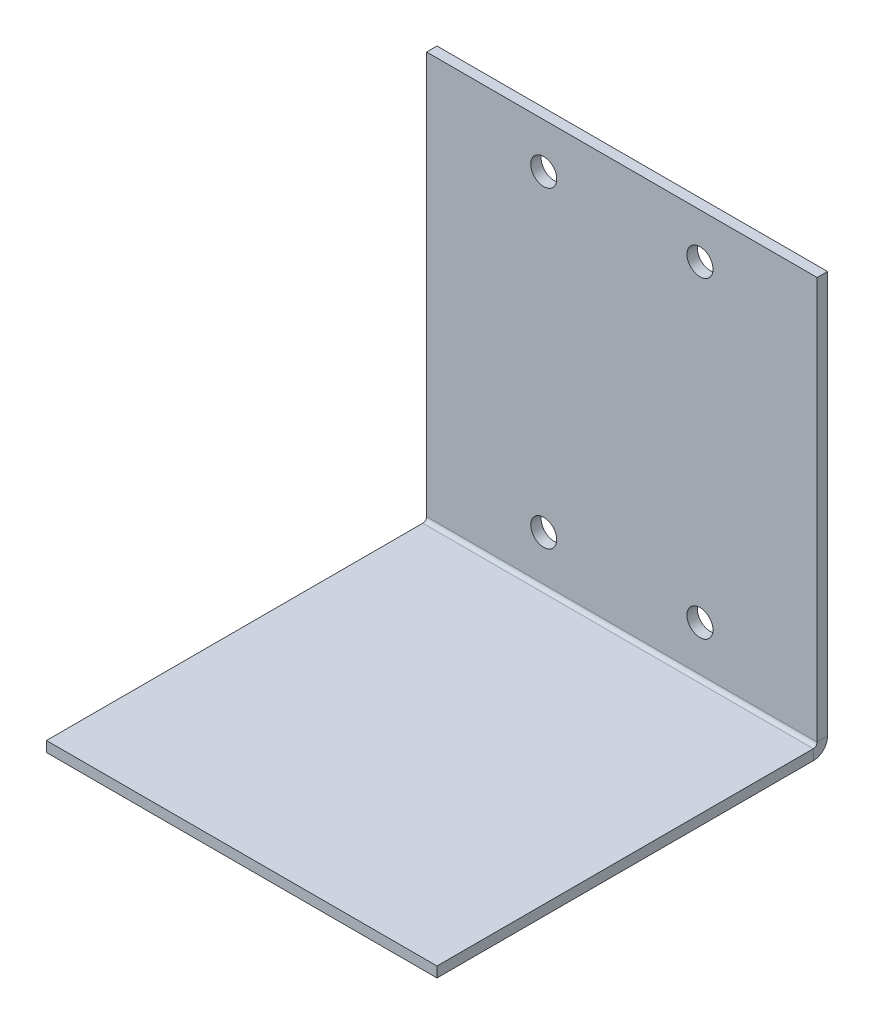
from build123d import *

# Parameters (mm, degrees)
SKETCH2_W                    = 75
SKETCH2_H                    = 80
BASE_FLANGE1_DEPTH           = 2
EDGE_FLANGE1_STRIP_W         = 9.4732
EDGE_FLANGE1_STRIP_H         = 2
EDGE_FLANGE1_STRIP_CUT_DEPTH = 75
EDGE_FLANGE1_DEPTH           = 75
CUT_EXTRUDE1_REACH           = 134.853
SKETCH10_R                   = 2.5


# Sheet-metal steps are written as plain solids
with BuildPart() as part:
    # Sketch2 → Base-Flange1 (new body)
    with BuildSketch(Plane.XY):
        with Locations((37.5, 40)):
            Rectangle(SKETCH2_W, SKETCH2_H)
    extrude(amount=-BASE_FLANGE1_DEPTH)

    # Edge-Flange1 strip (across the edge) → Edge-Flange1 strip cut (cut)
    with BuildSketch(Plane.YZ):
        with Locations((-2, -1)):
            Rectangle(EDGE_FLANGE1_STRIP_W, EDGE_FLANGE1_STRIP_H)
    extrude(amount=EDGE_FLANGE1_STRIP_CUT_DEPTH, mode=Mode.SUBTRACT)

    # Edge-Flange1 section (across the edge) → Edge-Flange1 (add)
    with BuildSketch(Plane.YZ):
        with BuildLine():
            Line((0, 0.7366), (0, 73))
            Line((0, 73), (2, 73))
            Line((2, 73), (2, 0.7366))
            ThreePointArc((2, 0.7366), (2.215745145, 0.215745145), (2.7366, 0))
            Line((2.7366, 0), (2.7366, -2))
            ThreePointArc((2.7366, -2), (0.801531583, -1.198468417), (0, 0.7366))
        make_face()
    extrude(amount=EDGE_FLANGE1_DEPTH)

    # Sketch10 → Cut-Extrude1 (cut, up to next)
    with BuildSketch(Plane(origin=(0, 0, -2), x_dir=(-1, 0, 0), z_dir=(0, 0, -1)), mode=Mode.PRIVATE) as cut_extrude1_sk1:
        with Locations((-22.5, 11.37)):
            Circle(SKETCH10_R)
    cut_extrude1_tool1 = extrude(cut_extrude1_sk1.sketch, amount=-CUT_EXTRUDE1_REACH, mode=Mode.PRIVATE) & part.part
    # Sketch10 → Cut-Extrude1 (cut, up to next)
    with BuildSketch(Plane(origin=(0, 0, -2), x_dir=(-1, 0, 0), z_dir=(0, 0, -1)), mode=Mode.PRIVATE) as cut_extrude1_sk2:
        with Locations((-52.5, 71.37)):
            Circle(SKETCH10_R)
    cut_extrude1_tool2 = extrude(cut_extrude1_sk2.sketch, amount=-CUT_EXTRUDE1_REACH, mode=Mode.PRIVATE) & part.part
    # Sketch10 → Cut-Extrude1 (cut, up to next)
    with BuildSketch(Plane(origin=(0, 0, -2), x_dir=(-1, 0, 0), z_dir=(0, 0, -1)), mode=Mode.PRIVATE) as cut_extrude1_sk3:
        with Locations((-52.5, 11.3666)):
            Circle(SKETCH10_R)
    cut_extrude1_tool3 = extrude(cut_extrude1_sk3.sketch, amount=-CUT_EXTRUDE1_REACH, mode=Mode.PRIVATE) & part.part
    # Sketch10 → Cut-Extrude1 (cut, up to next)
    with BuildSketch(Plane(origin=(0, 0, -2), x_dir=(-1, 0, 0), z_dir=(0, 0, -1)), mode=Mode.PRIVATE) as cut_extrude1_sk4:
        with Locations((-22.5, 71.3666)):
            Circle(SKETCH10_R)
    cut_extrude1_tool4 = extrude(cut_extrude1_sk4.sketch, amount=-CUT_EXTRUDE1_REACH, mode=Mode.PRIVATE) & part.part
    add(cut_extrude1_tool1.solids().sort_by_distance((22.5, 11.37, -2))[0], mode=Mode.SUBTRACT)
    add(cut_extrude1_tool2.solids().sort_by_distance((52.5, 71.37, -2))[0], mode=Mode.SUBTRACT)
    add(cut_extrude1_tool3.solids().sort_by_distance((52.5, 11.3666, -2))[0], mode=Mode.SUBTRACT)
    add(cut_extrude1_tool4.solids().sort_by_distance((22.5, 71.3666, -2))[0], mode=Mode.SUBTRACT)


solid = part.part
